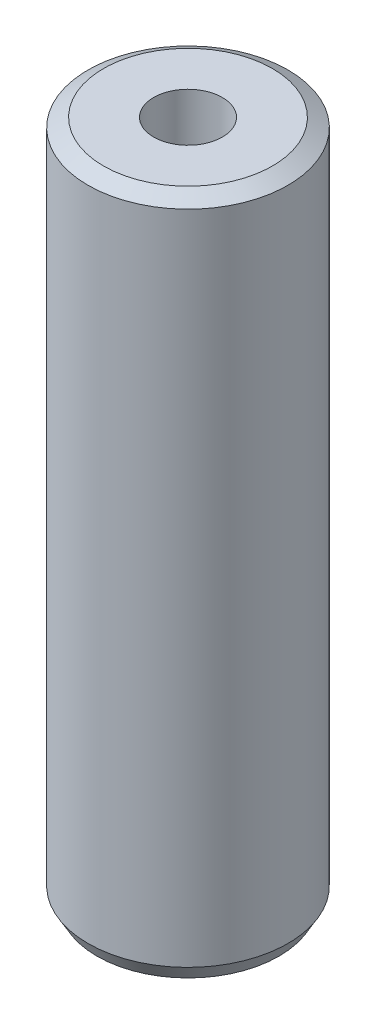
from build123d import *
from OCP.BRepFilletAPI import BRepFilletAPI_MakeChamfer

# Parameters (mm, degrees)
SKETCH1_R           = 30
BOSS_EXTRUDE1_DEPTH = 204.390626402
SKETCH2_R           = 10.304783991
CUT_EXTRUDE1_DEPTH  = 209.747522527
CHAMFER1_SIZE       = 2.684624961
CHAMFER1_SIZE2      = 4.649906831


with BuildPart() as part:
    # Sketch1 → Boss-Extrude1 (new body)
    with BuildSketch(Plane(origin=(0, 0, 0), x_dir=(1, 0, 0), z_dir=(0, 1, 0))):
        Circle(SKETCH1_R)
    extrude(amount=BOSS_EXTRUDE1_DEPTH)

    # Sketch2 → Cut-Extrude1 (cut, through all)
    with BuildSketch(Plane(origin=(0, 0, 0), x_dir=(1, 0, 0), z_dir=(0, 1, 0))):
        Circle(SKETCH2_R)
    extrude(amount=CUT_EXTRUDE1_DEPTH, mode=Mode.SUBTRACT)

    # Chamfer1: one chamfer whose edges measure the first distance from different faces: ONE call of the kernel's chamfer builder (chamfer() names one face for all edges)
    chamfer1_edges_1 = [part.edges().sort_by_distance(p)[0] for p in [
        (-30, 204.390626402, 0),
    ]]
    chamfer1_side_1 = [part.faces().sort_by_distance(p)[0] for p in [
        (-30, 102.195313201, 0),
    ]]
    chamfer1_edges_2 = [part.edges().sort_by_distance(p)[0] for p in [
        (-30, 0, 0),
    ]]
    chamfer1_side_2 = [part.faces().sort_by_distance(p)[0] for p in [
        (-29.151471863, 0, 0),
    ]]
    chamfer1 = BRepFilletAPI_MakeChamfer(part.part.solid().wrapped)
    for e in chamfer1_edges_1:
        chamfer1.Add(CHAMFER1_SIZE, CHAMFER1_SIZE2, e.wrapped, chamfer1_side_1[0].wrapped)  # the first distance lies on this face
    for e in chamfer1_edges_2:
        chamfer1.Add(CHAMFER1_SIZE, CHAMFER1_SIZE2, e.wrapped, chamfer1_side_2[0].wrapped)  # the first distance lies on this face
    add(Compound.cast(chamfer1.Shape()), mode=Mode.REPLACE)


solid = part.part
